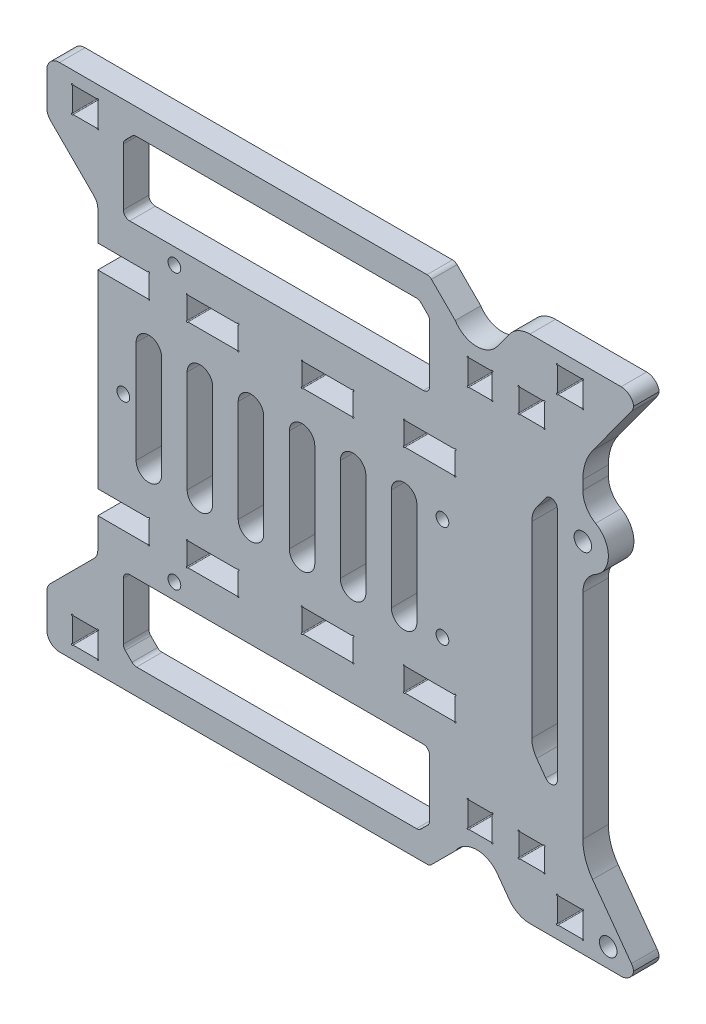
from build123d import *

# Parameters (mm, degrees)
BOSS_EXTRUDE1_DEPTH              = 6.35
FILLET1_R                        = 6.35
FILLET3_R                        = 3.175
FILLET4_R                        = 6.35
FILLET7_R                        = 1.5875
FILLET8_R                        = 1.5875
FILLET9_R                        = 1.5875
CUT_EXTRUDE1_DEPTH               = 119.108017538
CUT_EXTRUDE4_DEPTH               = 119.108017538
BOSS_EXTRUDE2_DEPTH              = 6.35
FILLET10_R                       = 1.5875
FILLET11_R                       = 12.7
F_11_64_0_17188_DIAMETER_HOLE1_D = 4.365752
SKETCH10_R                       = 1.5875
CUT_EXTRUDE6_DEPTH               = 119.108017538
BOSS_EXTRUDE4_DEPTH              = 6.35
CUT_EXTRUDE7_DEPTH               = 6.35
FILLET12_R                       = 3.175
F_11_64_0_17188_DIAMETER_HOLE2_D = 4.365752
CUT_EXTRUDE8_DEPTH               = 119.108017538
CUT_EXTRUDE9_DEPTH               = 119.108017538
BOSS_EXTRUDE5_START              = -6.35
SKETCH17_R                       = 6.35
SKETCH17_R_2                     = 2.182876
BOSS_EXTRUDE5_DEPTH              = 6.35
FILLET13_R                       = 6.35
SKETCH19_R                       = 1.5875
CUT_EXTRUDE10_DEPTH              = 119.108017538


with BuildPart() as part:
    # Sketch1 → Boss-Extrude1 (new body)
    with BuildSketch(Plane.XY):
        Polygon((70.327059007, -63.5), (99.425, -63.5), (99.425, -60.325), (74.025, -25.4), (74.025, 25.4), (99.425, 60.325), (99.425, 63.5), (70.327059007, 63.5), (65.708877189, 57.15), (54.975, 42.390918865), (54.975, 57.15), (48.625, 63.5), (-27.575, 63.5), (-33.925, 57.15), (-33.925, -57.15), (-27.575, -63.5), (48.625, -63.5), (54.975, -57.15), (54.975, -42.390918865), (65.708877189, -57.15), align=None)
        Polygon((-27.575, -38.1), (48.625, -38.1), (48.625, -54.519743879), (45.994743879, -57.15), (-24.944743879, -57.15), (-27.575, -54.519743879), align=None, mode=Mode.SUBTRACT)
        Polygon((48.625, 38.1), (-27.575, 38.1), (-27.575, 54.519743879), (-24.944743879, 57.15), (45.994743879, 57.15), (48.625, 54.519743879), align=None, mode=Mode.SUBTRACT)
    extrude(amount=BOSS_EXTRUDE1_DEPTH)

    # Fillet1
    # the kernel refuses this fillet: 6.35 mm, written as the material it adds along each edge
    with BuildSketch(Plane(origin=(54.975, -42.390918865, 0), x_dir=(0, -1, 0), z_dir=(0, 0, 1))) as fillet1_piece_1:
        with BuildLine():
            CenterArc((18.165117477, 5.359236553), FILLET1_R, 126.027373385, 111.534828963)
            Line((14.430227197, 10.494710689), (0, 0))
            Line((0, 0), (14.759081135, 0))
        make_face()
    extrude(amount=6.35)
    with BuildSketch(Plane(origin=(54.975, 42.390918865, 0), x_dir=(0, 1, 0), z_dir=(0, 0, 1))) as fillet1_piece_2:
        with BuildLine():
            CenterArc((18.165117477, -5.359236553), FILLET1_R, 122.437797652, 111.534828963)
            Line((14.430227197, -10.494710689), (0, 0))
            Line((0, 0), (14.759081135, 0))
        make_face()
    extrude(amount=6.35)
    # the kernel refuses this fillet: 6.35 mm, written as the material it takes off along each edge
    with BuildSketch(Plane(origin=(70.327059007, 63.5, -8.083940393), x_dir=(1, 0, 0), z_dir=(0, 0, 1))) as fillet1_2_piece_1:
        with BuildLine():
            CenterArc((FILLET1_R * 0.509224591703, -FILLET1_R), FILLET1_R, 90, 53.972626615)
            Line((-FILLET1_R * 0.2995114926, -FILLET1_R * 0.411828302325), (0, 0))
            Line((0, 0), (FILLET1_R * 0.509224591703, 0))
        make_face()
    extrude(amount=22.517880787, mode=Mode.SUBTRACT)
    with BuildSketch(Plane(origin=(70.327059007, -63.5, -8.083940393), x_dir=(1, 0, 0), z_dir=(0, 0, 1))) as fillet1_2_piece_2:
        with BuildLine():
            CenterArc((FILLET1_R * 0.509224591703, FILLET1_R), FILLET1_R, 216.027373385, 53.972626615)
            Line((-FILLET1_R * 0.2995114926, FILLET1_R * 0.411828302325), (0, 0))
            Line((0, 0), (FILLET1_R * 0.509224591703, 0))
        make_face()
    extrude(amount=22.517880787, mode=Mode.SUBTRACT)

    # Fillet3
    # the kernel refuses this fillet: 3.175 mm, written as the material it takes off along each edge
    with BuildSketch(Plane(origin=(99.425, 63.5, -7.9375), x_dir=(0, -1, 0), z_dir=(0, 0, 1)), Plane(origin=(99.425, -63.5, -7.9375), x_dir=(-1, 0, 0), z_dir=(0, 0, 1))) as fillet3_piece_1:
        with BuildLine():
            CenterArc((FILLET3_R, -FILLET3_R), FILLET3_R, 90, 90)
            Line((0, -FILLET3_R), (0, 0))
            Line((0, 0), (FILLET3_R, 0))
        make_face()
    extrude(amount=22.225, mode=Mode.SUBTRACT)
    with BuildSketch(Plane(origin=(99.425, 60.325, -2.58114652), x_dir=(-0.5881716976750437, -0.8087360843031903, 0), z_dir=(0, 0, 1)), Plane(origin=(99.425, -60.325, -2.58114652), x_dir=(0, -1, 0), z_dir=(0, 0, 1))) as fillet3_piece_2:
        with BuildLine():
            CenterArc((FILLET3_R * 0.325183813592, -FILLET3_R), FILLET3_R, 90, 36.027373385)
            Line((-FILLET3_R * 0.262987884083, -FILLET3_R * 0.191263915697), (0, 0))
            Line((0, 0), (FILLET3_R * 0.325183813592, 0))
        make_face()
    extrude(amount=11.512293041, mode=Mode.SUBTRACT)

    # Fillet4
    fillet4_edges = [part.edges().sort_by_distance(p)[0] for p in [
        (74.025, 25.4, 3.175),
        (74.025, -25.4, 3.175),
    ]]
    fillet(fillet4_edges, radius=FILLET4_R)

    # Fillet7
    fillet7_edges = [part.edges().sort_by_distance(p)[0] for p in [
        (-27.575, 38.1, 3.175),
        (48.625, 38.1, 3.175),
        (48.625, -38.1, 3.175),
        (-27.575, -38.1, 3.175),
    ]]
    fillet(fillet7_edges, radius=FILLET7_R)

    # Fillet8
    fillet8_edges = [part.edges().sort_by_distance(p)[0] for p in [
        (48.625, -63.5, 3.175),
        (48.625, 63.5, 3.175),
    ]]
    fillet(fillet8_edges, radius=FILLET8_R)

    # Fillet9
    fillet9_edges = [part.edges().sort_by_distance(p)[0] for p in [
        (-24.944743879, 57.15, 3.175),
        (-27.575, 54.519743879, 3.175),
        (48.625, 54.519743879, 3.175),
        (45.994743879, 57.15, 3.175),
        (48.625, -54.519743879, 3.175),
        (-27.575, -54.519743879, 3.175),
        (-24.944743879, -57.15, 3.175),
        (45.994743879, -57.15, 3.175),
    ]]
    fillet(fillet9_edges, radius=FILLET9_R)

    # Sketch2 → Cut-Extrude1 (cut, through all)
    with BuildSketch(Plane.XY.offset(6.35)):
        with BuildLine():
            Line((58.3484375, 50.8), (63.9713625, 50.8))
            ThreePointArc((63.9713625, 50.8), (64.310116502, 50.940316502), (64.1698, 50.6015625))
            Line((64.1698, 50.6015625), (64.1698, 44.6484375))
            ThreePointArc((64.1698, 44.6484375), (64.310116502, 44.309683498), (63.9713625, 44.45))
            Line((63.9713625, 44.45), (58.3484375, 44.45))
            ThreePointArc((58.3484375, 44.45), (58.009683498, 44.309683498), (58.15, 44.6484375))
            Line((58.15, 44.6484375), (58.15, 50.6015625))
            ThreePointArc((58.15, 50.6015625), (58.009683498, 50.940316502), (58.3484375, 50.8))
        make_face()
        with BuildLine():
            Line((64.1698, -50.6015625), (64.1698, -44.6484375))
            ThreePointArc((64.1698, -44.6484375), (64.310116502, -44.309683498), (63.9713625, -44.45))
            Line((63.9713625, -44.45), (58.3484375, -44.45))
            ThreePointArc((58.3484375, -44.45), (58.009683498, -44.309683498), (58.15, -44.6484375))
            Line((58.15, -44.6484375), (58.15, -50.6015625))
            ThreePointArc((58.15, -50.6015625), (58.009683498, -50.940316502), (58.3484375, -50.8))
            Line((58.3484375, -50.8), (63.9713625, -50.8))
            ThreePointArc((63.9713625, -50.8), (64.310116502, -50.940316502), (64.1698, -50.6015625))
        make_face()
    extrude(amount=-CUT_EXTRUDE1_DEPTH, mode=Mode.SUBTRACT)

    # Sketch5 → Cut-Extrude4 (cut, through all)
    with BuildSketch(Plane.XY.offset(6.35)):
        with BuildLine():
            Line((-11.5015625, 29.36748), (0.8015625, 29.36748))
            ThreePointArc((0.8015625, 29.36748), (1.140316502, 29.507796502), (1, 29.1690425))
            Line((1, 29.1690425), (1, 23.7747175))
            ThreePointArc((1, 23.7747175), (1.140316502, 23.435963498), (0.8015625, 23.57628))
            Line((0.8015625, 23.57628), (-11.5015625, 23.57628))
            ThreePointArc((-11.5015625, 23.57628), (-11.840316502, 23.435963498), (-11.7, 23.7747175))
            Line((-11.7, 23.7747175), (-11.7, 29.1690425))
            ThreePointArc((-11.7, 29.1690425), (-11.840316502, 29.507796502), (-11.5015625, 29.36748))
        make_face()
        with BuildLine():
            Line((42.4734375, 29.36748), (54.7765625, 29.36748))
            ThreePointArc((54.7765625, 29.36748), (55.115316502, 29.507796502), (54.975, 29.1690425))
            Line((54.975, 29.1690425), (54.975, 23.7747175))
            ThreePointArc((54.975, 23.7747175), (55.115316502, 23.435963498), (54.7765625, 23.57628))
            Line((54.7765625, 23.57628), (42.4734375, 23.57628))
            ThreePointArc((42.4734375, 23.57628), (42.134683498, 23.435963498), (42.275, 23.7747175))
            Line((42.275, 23.7747175), (42.275, 29.1690425))
            ThreePointArc((42.275, 29.1690425), (42.134683498, 29.507796502), (42.4734375, 29.36748))
        make_face()
        with BuildLine():
            Line((29.3765625, 29.36748), (17.0734375, 29.36748))
            ThreePointArc((17.0734375, 29.36748), (16.734683498, 29.507796502), (16.875, 29.1690425))
            Line((16.875, 29.1690425), (16.875, 23.7747175))
            ThreePointArc((16.875, 23.7747175), (16.734683498, 23.435963498), (17.0734375, 23.57628))
            Line((17.0734375, 23.57628), (29.3765625, 23.57628))
            ThreePointArc((29.3765625, 23.57628), (29.715316502, 23.435963498), (29.575, 23.7747175))
            Line((29.575, 23.7747175), (29.575, 29.1690425))
            ThreePointArc((29.575, 29.1690425), (29.715316502, 29.507796502), (29.3765625, 29.36748))
        make_face()
        with BuildLine():
            Line((-21.4234375, 29.36748), (-33.925, 29.36748))
            Line((-33.925, 29.36748), (-33.925, 23.57628))
            Line((-33.925, 23.57628), (-21.4234375, 23.57628))
            ThreePointArc((-21.4234375, 23.57628), (-21.084683498, 23.435963498), (-21.225, 23.7747175))
            Line((-21.225, 23.7747175), (-21.225, 29.1690425))
            ThreePointArc((-21.225, 29.1690425), (-21.084683498, 29.507796502), (-21.4234375, 29.36748))
        make_face()
        with BuildLine():
            Line((-33.925, -29.36748), (-33.925, -23.57628))
            Line((-33.925, -23.57628), (-21.4234375, -23.57628))
            ThreePointArc((-21.4234375, -23.57628), (-21.084683498, -23.435963498), (-21.225, -23.7747175))
            Line((-21.225, -23.7747175), (-21.225, -29.1690425))
            ThreePointArc((-21.225, -29.1690425), (-21.084683498, -29.507796502), (-21.4234375, -29.36748))
            Line((-21.4234375, -29.36748), (-33.925, -29.36748))
        make_face()
        with BuildLine():
            Line((16.875, -29.1690425), (16.875, -23.7747175))
            ThreePointArc((16.875, -23.7747175), (16.734683498, -23.435963498), (17.0734375, -23.57628))
            Line((17.0734375, -23.57628), (29.3765625, -23.57628))
            ThreePointArc((29.3765625, -23.57628), (29.715316502, -23.435963498), (29.575, -23.7747175))
            Line((29.575, -23.7747175), (29.575, -29.1690425))
            ThreePointArc((29.575, -29.1690425), (29.715316502, -29.507796502), (29.3765625, -29.36748))
            Line((29.3765625, -29.36748), (17.0734375, -29.36748))
            ThreePointArc((17.0734375, -29.36748), (16.734683498, -29.507796502), (16.875, -29.1690425))
        make_face()
        with BuildLine():
            Line((54.975, -29.1690425), (54.975, -23.7747175))
            ThreePointArc((54.975, -23.7747175), (55.115316502, -23.435963498), (54.7765625, -23.57628))
            Line((54.7765625, -23.57628), (42.4734375, -23.57628))
            ThreePointArc((42.4734375, -23.57628), (42.134683498, -23.435963498), (42.275, -23.7747175))
            Line((42.275, -23.7747175), (42.275, -29.1690425))
            ThreePointArc((42.275, -29.1690425), (42.134683498, -29.507796502), (42.4734375, -29.36748))
            Line((42.4734375, -29.36748), (54.7765625, -29.36748))
            ThreePointArc((54.7765625, -29.36748), (55.115316502, -29.507796502), (54.975, -29.1690425))
        make_face()
        with BuildLine():
            Line((1, -29.1690425), (1, -23.7747175))
            ThreePointArc((1, -23.7747175), (1.140316502, -23.435963498), (0.8015625, -23.57628))
            Line((0.8015625, -23.57628), (-11.5015625, -23.57628))
            ThreePointArc((-11.5015625, -23.57628), (-11.840316502, -23.435963498), (-11.7, -23.7747175))
            Line((-11.7, -23.7747175), (-11.7, -29.1690425))
            ThreePointArc((-11.7, -29.1690425), (-11.840316502, -29.507796502), (-11.5015625, -29.36748))
            Line((-11.5015625, -29.36748), (0.8015625, -29.36748))
            ThreePointArc((0.8015625, -29.36748), (1.140316502, -29.507796502), (1, -29.1690425))
        make_face()
    extrude(amount=-CUT_EXTRUDE4_DEPTH, mode=Mode.SUBTRACT)

    # Sketch6 → Boss-Extrude2 (add)
    with BuildSketch(Plane.XY.offset(6.35)):
        Polygon((80.375, 34.13125), (80.375, -34.13125), (86.725, -42.8625), (86.725, -34.13125), (86.725, 34.13125), (86.725, 42.8625), align=None)
    extrude(amount=-BOSS_EXTRUDE2_DEPTH)

    # Fillet10
    fillet10_edges = [part.edges().sort_by_distance(p)[0] for p in [
        (80.375, 34.13125, 3.175),
        (80.375, -34.13125, 3.175),
    ]]
    fillet(fillet10_edges, radius=FILLET10_R)

    # Fillet11
    fillet11_edges = [part.edges().sort_by_distance(p)[0] for p in [
        (86.725, 42.8625, 3.175),
        (86.725, -42.8625, 3.175),
    ]]
    fillet(fillet11_edges, radius=FILLET11_R)

    # 11/64 (0.17188) Diameter Hole1 (through all)
    with Locations(Plane.XY.offset(6.35)):
        with Locations((86.725, 25.4)):
            Hole(F_11_64_0_17188_DIAMETER_HOLE1_D / 2)

    # Sketch10 → Cut-Extrude6 (cut, through all)
    with BuildSketch(Plane.XY.offset(6.35)):
        with Locations((51.8, 12.7)):
            Circle(SKETCH10_R)
        with Locations(Location((51.8, -12.7, 0), (0, 0, 180))):
            Circle(SKETCH10_R)
        with Locations((-27.575, 0)):
            Circle(SKETCH10_R)
    extrude(amount=-CUT_EXTRUDE6_DEPTH, mode=Mode.SUBTRACT)

    # Sketch11 → Boss-Extrude4 (add)
    with BuildSketch(Plane.XY.offset(6.35)):
        Polygon((-27.575, -63.5), (-33.925, -57.15), (-33.925, -50.8), (-33.925, -38.1), (-46.625, -50.8), (-46.625, -63.5), align=None)
        Polygon((-46.625, 63.5), (-27.575, 63.5), (-33.925, 57.15), (-33.925, 50.8), (-33.925, 38.1), (-46.625, 50.8), align=None)
    extrude(amount=-BOSS_EXTRUDE4_DEPTH)

    # Sketch12 → Cut-Extrude7 (cut)
    with BuildSketch(Plane.XY.offset(6.35)):
        with BuildLine():
            Line((86.5265625, -60.325), (80.5734375, -60.325))
            ThreePointArc((80.5734375, -60.325), (80.234683498, -60.465316502), (80.375, -60.1265625))
            Line((80.375, -60.1265625), (80.375, -54.1734375))
            ThreePointArc((80.375, -54.1734375), (80.234683498, -53.834683498), (80.5734375, -53.975))
            Line((80.5734375, -53.975), (86.5265625, -53.975))
            ThreePointArc((86.5265625, -53.975), (86.865316502, -53.834683498), (86.725, -54.1734375))
            Line((86.725, -54.1734375), (86.725, -60.1265625))
            ThreePointArc((86.725, -60.1265625), (86.865316502, -60.465316502), (86.5265625, -60.325))
        make_face()
        with BuildLine():
            Line((86.725, 60.1265625), (86.725, 54.1734375))
            ThreePointArc((86.725, 54.1734375), (86.865316502, 53.834683498), (86.5265625, 53.975))
            Line((86.5265625, 53.975), (80.5734375, 53.975))
            ThreePointArc((80.5734375, 53.975), (80.234683498, 53.834683498), (80.375, 54.1734375))
            Line((80.375, 54.1734375), (80.375, 60.1265625))
            ThreePointArc((80.375, 60.1265625), (80.234683498, 60.465316502), (80.5734375, 60.325))
            Line((80.5734375, 60.325), (86.5265625, 60.325))
            ThreePointArc((86.5265625, 60.325), (86.865316502, 60.465316502), (86.725, 60.1265625))
        make_face()
        with BuildLine():
            Line((-34.1234375, -60.325), (-40.0765625, -60.325))
            ThreePointArc((-40.0765625, -60.325), (-40.415316502, -60.465316502), (-40.275, -60.1265625))
            Line((-40.275, -60.1265625), (-40.275, -54.1734375))
            ThreePointArc((-40.275, -54.1734375), (-40.415316502, -53.834683498), (-40.0765625, -53.975))
            Line((-40.0765625, -53.975), (-34.1234375, -53.975))
            ThreePointArc((-34.1234375, -53.975), (-33.784683498, -53.834683498), (-33.925, -54.1734375))
            Line((-33.925, -54.1734375), (-33.925, -60.1265625))
            ThreePointArc((-33.925, -60.1265625), (-33.784683498, -60.465316502), (-34.1234375, -60.325))
        make_face()
        with BuildLine():
            Line((-34.1234375, 60.325), (-40.0765625, 60.325))
            ThreePointArc((-40.0765625, 60.325), (-40.415316502, 60.465316502), (-40.275, 60.1265625))
            Line((-40.275, 60.1265625), (-40.275, 54.1734375))
            ThreePointArc((-40.275, 54.1734375), (-40.415316502, 53.834683498), (-40.0765625, 53.975))
            Line((-40.0765625, 53.975), (-34.1234375, 53.975))
            ThreePointArc((-34.1234375, 53.975), (-33.784683498, 53.834683498), (-33.925, 54.1734375))
            Line((-33.925, 54.1734375), (-33.925, 60.1265625))
            ThreePointArc((-33.925, 60.1265625), (-33.784683498, 60.465316502), (-34.1234375, 60.325))
        make_face()
    extrude(amount=-CUT_EXTRUDE7_DEPTH, mode=Mode.SUBTRACT)

    # Fillet12
    fillet12_edges = [part.edges().sort_by_distance(p)[0] for p in [
        (-46.625, -63.5, 3.175),
        (-46.625, -50.8, 3.175),
        (-33.925, -38.1, 3.175),
        (-46.625, 50.8, 3.175),
        (-46.625, 63.5, 3.175),
        (-33.925, 38.1, 3.175),
    ]]
    fillet(fillet12_edges, radius=FILLET12_R)

    # 11/64 (0.17188) Diameter Hole2 (through all)
    with Locations(Plane(origin=(0, 0, 0), x_dir=(-1, 0, 0), z_dir=(0, 0, -1))):
        with Locations((-93.032751555, -58.7375)):
            Hole(F_11_64_0_17188_DIAMETER_HOLE2_D / 2)

    # Sketch15 → Cut-Extrude8 (cut, through all)
    with BuildSketch(Plane.XY.offset(6.35)):
        with BuildLine():
            Line((-24.4, -12.7), (-24.4, 12.7))
            ThreePointArc((-24.4, 12.7), (-21.225, 15.875), (-18.05, 12.7))
            Line((-18.05, 12.7), (-18.05, -12.7))
            ThreePointArc((-18.05, -12.7), (-21.225, -15.875), (-24.4, -12.7))
        make_face()
        with BuildLine():
            Line((-11.7, -12.7), (-11.7, 12.7))
            ThreePointArc((-11.7, 12.7), (-8.525, 15.875), (-5.35, 12.7))
            Line((-5.35, 12.7), (-5.35, -12.7))
            ThreePointArc((-5.35, -12.7), (-8.525, -15.875), (-11.7, -12.7))
        make_face()
        with BuildLine():
            Line((1, -12.7), (1, 12.7))
            ThreePointArc((1, 12.7), (4.175, 15.875), (7.35, 12.7))
            Line((7.35, 12.7), (7.35, -12.7))
            ThreePointArc((7.35, -12.7), (4.175, -15.875), (1, -12.7))
        make_face()
        with BuildLine():
            Line((13.7, -12.7), (13.7, 12.7))
            ThreePointArc((13.7, 12.7), (16.875, 15.875), (20.05, 12.7))
            Line((20.05, 12.7), (20.05, -12.7))
            ThreePointArc((20.05, -12.7), (16.875, -15.875), (13.7, -12.7))
        make_face()
        with BuildLine():
            Line((26.4, -12.7), (26.4, 12.7))
            ThreePointArc((26.4, 12.7), (29.575, 15.875), (32.75, 12.7))
            Line((32.75, 12.7), (32.75, -12.7))
            ThreePointArc((32.75, -12.7), (29.575, -15.875), (26.4, -12.7))
        make_face()
        with BuildLine():
            Line((39.1, -12.7), (39.1, 12.7))
            ThreePointArc((39.1, 12.7), (42.275, 15.875), (45.45, 12.7))
            Line((45.45, 12.7), (45.45, -12.7))
            ThreePointArc((45.45, -12.7), (42.275, -15.875), (39.1, -12.7))
        make_face()
    extrude(amount=-CUT_EXTRUDE8_DEPTH, mode=Mode.SUBTRACT)

    # Sketch16 → Cut-Extrude9 (cut, through all)
    with BuildSketch(Plane.XY.offset(6.35)):
        with BuildLine():
            Line((76.959314055, 50.8), (71.006189055, 50.8))
            ThreePointArc((71.006189055, 50.8), (70.667435053, 50.940316502), (70.807751555, 50.6015625))
            Line((70.807751555, 50.6015625), (70.807751555, 45.1564375))
            ThreePointArc((70.807751555, 45.1564375), (70.667435053, 44.817683498), (71.006189055, 44.958))
            Line((71.006189055, 44.958), (76.959314055, 44.958))
            ThreePointArc((76.959314055, 44.958), (77.298068057, 44.817683498), (77.157751555, 45.1564375))
            Line((77.157751555, 45.1564375), (77.157751555, 50.6015625))
            ThreePointArc((77.157751555, 50.6015625), (77.298068057, 50.940316502), (76.959314055, 50.8))
        make_face()
        with BuildLine():
            Line((70.807751555, -50.6015625), (70.807751555, -45.1564375))
            ThreePointArc((70.807751555, -45.1564375), (70.667435053, -44.817683498), (71.006189055, -44.958))
            Line((71.006189055, -44.958), (76.959314055, -44.958))
            ThreePointArc((76.959314055, -44.958), (77.298068057, -44.817683498), (77.157751555, -45.1564375))
            Line((77.157751555, -45.1564375), (77.157751555, -50.6015625))
            ThreePointArc((77.157751555, -50.6015625), (77.298068057, -50.940316502), (76.959314055, -50.8))
            Line((76.959314055, -50.8), (71.006189055, -50.8))
            ThreePointArc((71.006189055, -50.8), (70.667435053, -50.940316502), (70.807751555, -50.6015625))
        make_face()
    extrude(amount=-CUT_EXTRUDE9_DEPTH, mode=Mode.SUBTRACT)

    # Sketch17 → Boss-Extrude5 (add)
    with BuildSketch(Plane.XY.offset(6.35).offset(BOSS_EXTRUDE5_START)):
        with Locations((86.725, 25.4)):
            Circle(SKETCH17_R)
        with Locations((86.725, 25.4)):
            Circle(SKETCH17_R_2, mode=Mode.SUBTRACT)
    extrude(amount=BOSS_EXTRUDE5_DEPTH)

    # Fillet13
    fillet13_edges = [part.edges().sort_by_distance(p)[0] for p in [
        (86.725, 31.75, 3.175),
        (86.725, 19.05, 3.175),
    ]]
    fillet(fillet13_edges, radius=FILLET13_R)

    # Sketch19 → Cut-Extrude10 (cut, through all)
    with BuildSketch(Plane(origin=(0, 0, 0), x_dir=(-1, 0, 0), z_dir=(0, 0, -1))):
        with Locations((14.875, -34.13125)):
            Circle(SKETCH19_R)
        with Locations(Location((14.875, 34.13125, 0), (0, 0, 180))):
            Circle(SKETCH19_R)
    extrude(amount=-CUT_EXTRUDE10_DEPTH, mode=Mode.SUBTRACT)


solid = part.part
